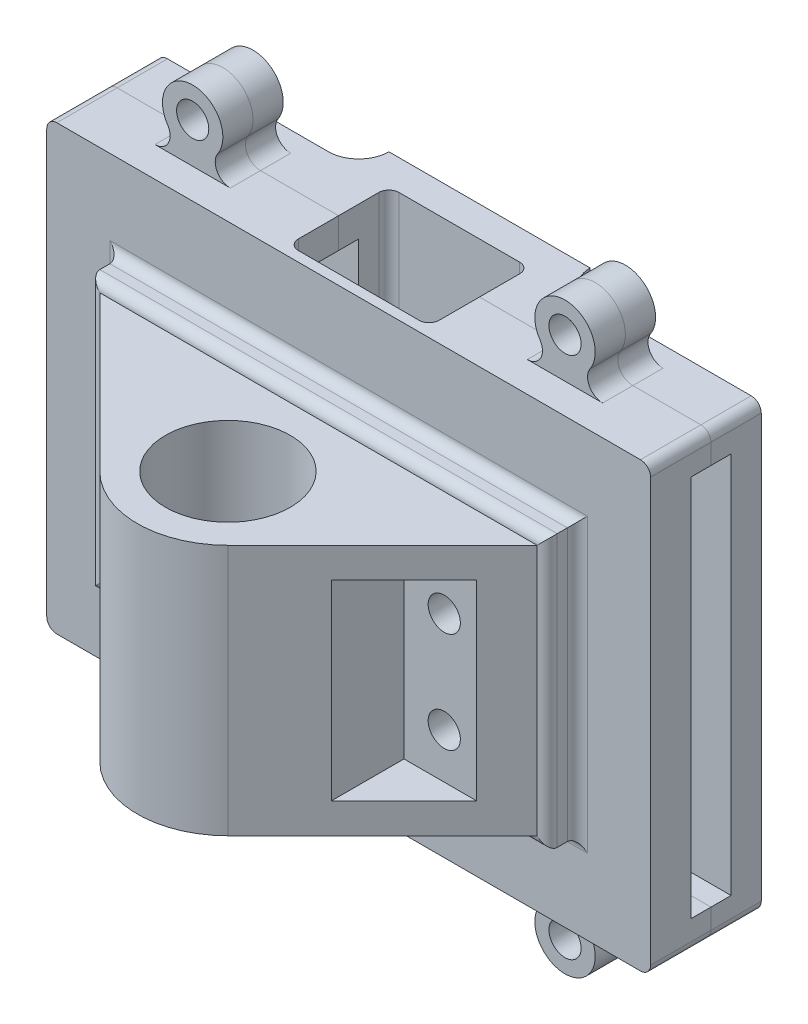
from build123d import *

# Parameters (mm, degrees)
EXTRUDE_1_DEPTH     = 25
SKETCH_2_R          = 6.2
CUT_EXTRUDE_1_DEPTH = 20
SKETCH_3_W          = 18.236171571
SKETCH_3_H          = 19
CUT_EXTRUDE_2_DEPTH = 15
SKETCH_5_W          = 60
SKETCH_5_H          = 44
EXTRUDE_2_DEPTH     = 14
SKETCH_6_W          = 4
SKETCH_6_H          = 38
CUT_EXTRUDE_4_DEPTH = 73.933188604
SKETCH_7_W          = 14
SKETCH_7_H          = 44
CUT_EXTRUDE_5_DEPTH = 10
SKETCH_9_R          = 1.6
EXTRUDE_3_DEPTH     = 3
SKETCH_10_W         = 20
SKETCH_10_H         = 44
EXTRUDE_4_DEPTH     = 3
FILLET_1_R          = 3
FILLET_2_R          = 1
FILLET_3_R          = 1
SKETCH_4_R          = 1.6
CUT_EXTRUDE_3_DEPTH = 10
CUT_EXTRUDE_6_DEPTH = 4
CUT_EXTRUDE_START   = -3
SKETCH_11_W         = 45.455844122
SKETCH_11_H         = 27
CUT_EXTRUDE_7_DEPTH = 3
FILLET_4_R          = 1
FILLET_5_R          = 1


# Read off the part's stored shape, not the designer's step: 分割2
with BuildPart() as part:
    # 草图1 → 凸台-拉伸1 (new body)
    with BuildSketch(Plane(origin=(0, 0, 0), x_dir=(1, 0, 0), z_dir=(0, 1, 0))):
        with BuildLine():
            ThreePointArc((-6.363961031, -6.363961031), (-8.314915793, 3.444150891), (-1e-09, 9))
            Line((-1e-09, 9), (-21.727922061, 9))
            Line((-21.727922061, 9), (-6.363961031, -6.363961031))
        make_face()
        with BuildLine():
            Line((21.727922061, 9), (-1e-09, 9))
            ThreePointArc((-1e-09, 9), (6.36396103, 6.363961031), (9, 0))
            ThreePointArc((9, 0), (8.314915793, -3.444150891), (6.363961031, -6.363961031))
            Line((6.363961031, -6.363961031), (21.727922061, 9))
        make_face()
        with BuildLine():
            ThreePointArc((9, 0), (6.36396103, 6.363961031), (-1e-09, 9))
            Line((0, 9), (0, -9))
            ThreePointArc((0, -9), (3.444150891, -8.314915793), (6.363961031, -6.363961031))
            ThreePointArc((6.363961031, -6.363961031), (8.314915793, -3.444150891), (9, 0))
        make_face()
        with BuildLine():
            Line((0, -9), (0, 9))
            ThreePointArc((-1e-09, 9), (-8.314915793, 3.444150891), (-6.363961031, -6.363961031))
            ThreePointArc((-6.363961031, -6.363961031), (-3.444150891, -8.314915793), (0, -9))
        make_face()
    extrude(amount=EXTRUDE_1_DEPTH)

    # 草图2 → 切除-拉伸1 (cut)
    with BuildSketch(Plane(origin=(0, 25, 0), x_dir=(1, 0, 0), z_dir=(0, 1, 0))):
        with Locations(Location((0, 0, 0), (0, 0, 270))):
            Circle(SKETCH_2_R)
    extrude(amount=-CUT_EXTRUDE_1_DEPTH, mode=Mode.SUBTRACT)

    # 草图3 → 切除-拉伸2 (cut)
    with BuildSketch(Plane.XY.offset(9)):
        with Locations((20.618085785, 12.5)):
            Rectangle(SKETCH_3_W, SKETCH_3_H)
        with Locations((-20.618085785, 12.5)):
            Rectangle(SKETCH_3_W, SKETCH_3_H)
    extrude(amount=-CUT_EXTRUDE_2_DEPTH, mode=Mode.SUBTRACT)

    # 草图5 → 凸台-拉伸2 (add)
    with BuildSketch(Plane(origin=(0, 0, -9), x_dir=(-1, 0, 0), z_dir=(0, 0, -1))):
        with Locations((0, 12.5)):
            Rectangle(SKETCH_5_W, SKETCH_5_H)
    extrude(amount=EXTRUDE_2_DEPTH)

    # 草图6 → 切除-拉伸4 (cut, through all)
    with BuildSketch(Plane.ZY.offset(30)):
        with Locations((-18, 12.5)):
            Rectangle(SKETCH_6_W, SKETCH_6_H)
    extrude(amount=-CUT_EXTRUDE_4_DEPTH, mode=Mode.SUBTRACT)

    # 草图7 → 切除-拉伸5 (cut)
    with BuildSketch(Plane(origin=(0, 0, -23), x_dir=(-1, 0, 0), z_dir=(0, 0, -1))):
        with Locations((0, 12.5)):
            Rectangle(SKETCH_7_W, SKETCH_7_H)
    extrude(amount=-CUT_EXTRUDE_5_DEPTH, mode=Mode.SUBTRACT)

    # 草图9 → 凸台-拉伸3 (add, symmetric)
    # profile 1 of 4: a face of its own
    with BuildSketch(Plane(origin=(0, 0, -18), x_dir=(-1, 0, 0), z_dir=(0, 0, -1))):
        with BuildLine():
            Line((-22.241657387, 34.5), (-14.758342613, 34.5))
            ThreePointArc((-14.758342613, 34.5), (-16.081218269, 35.292893219), (-16.005561742, 36.833333333))
            ThreePointArc((-16.005561742, 36.833333333), (-18.5, 41.5), (-20.994438258, 36.833333333))
            ThreePointArc((-20.994438258, 36.833333333), (-20.918781731, 35.292893219), (-22.241657387, 34.5))
        make_face()
        with Locations(Location((-18.5, 38.5, 0), (0, 0, 90))):
            Circle(SKETCH_9_R, mode=Mode.SUBTRACT)
    # profile 2 of 4: a face of its own
    with BuildSketch(Plane(origin=(0, 0, -18), x_dir=(-1, 0, 0), z_dir=(0, 0, -1))):
        with BuildLine():
            Line((22.241657387, 34.5), (14.758342613, 34.5))
            ThreePointArc((14.758342613, 34.5), (16.081218269, 35.292893219), (16.005561742, 36.833333333))
            ThreePointArc((16.005561742, 36.833333333), (18.5, 41.5), (20.994438258, 36.833333333))
            ThreePointArc((20.994438258, 36.833333333), (20.918781731, 35.292893219), (22.241657387, 34.5))
        make_face()
        with Locations(Location((18.5, 38.5, 0), (0, 0, 270))):
            Circle(SKETCH_9_R, mode=Mode.SUBTRACT)
    # profile 3 of 4: a face of its own
    with BuildSketch(Plane(origin=(0, 0, -18), x_dir=(-1, 0, 0), z_dir=(0, 0, -1))):
        with BuildLine():
            Line((-22.241657387, -9.5), (-14.758342613, -9.5))
            ThreePointArc((-14.758342613, -9.5), (-16.081218269, -10.292893219), (-16.005561742, -11.833333333))
            ThreePointArc((-16.005561742, -11.833333333), (-18.5, -16.5), (-20.994438258, -11.833333333))
            ThreePointArc((-20.994438258, -11.833333333), (-20.918781731, -10.292893219), (-22.241657387, -9.5))
        make_face()
        with Locations(Location((-18.5, -13.5, 0), (0, 0, 270))):
            Circle(SKETCH_9_R, mode=Mode.SUBTRACT)
    # profile 4 of 4: a face of its own
    with BuildSketch(Plane(origin=(0, 0, -18), x_dir=(-1, 0, 0), z_dir=(0, 0, -1))):
        with BuildLine():
            Line((22.241657387, -9.5), (14.758342613, -9.5))
            ThreePointArc((14.758342613, -9.5), (16.081218269, -10.292893219), (16.005561742, -11.833333333))
            ThreePointArc((16.005561742, -11.833333333), (18.5, -16.5), (20.994438258, -11.833333333))
            ThreePointArc((20.994438258, -11.833333333), (20.918781731, -10.292893219), (22.241657387, -9.5))
        make_face()
        with Locations(Location((18.5, -13.5, 0), (0, 0, 90))):
            Circle(SKETCH_9_R, mode=Mode.SUBTRACT)
    extrude(amount=EXTRUDE_3_DEPTH, both=True)

    # 草图10 → 凸台-拉伸4 (add)
    with BuildSketch(Plane(origin=(0, 0, -23), x_dir=(-1, 0, 0), z_dir=(0, 0, -1))):
        with Locations((0, 12.5)):
            Rectangle(SKETCH_10_W, SKETCH_10_H)
    extrude(amount=EXTRUDE_4_DEPTH)

    # 圆角1
    fillet_1_edges = [part.edges().sort_by_distance(p)[0] for p in [
        (-10, 12.5, -23),
        (10, 12.5, -23),
    ]]
    fillet(fillet_1_edges, radius=FILLET_1_R - 0.0001)  # a hair under: the kernel refuses the full size

    # 圆角2
    fillet_2_edges = [part.edges().sort_by_distance(p)[0] for p in [
        (-7, 12.5, -13),
        (7, 12.5, -13),
        (-7, 12.5, -23),
        (7, 12.5, -23),
    ]]
    fillet(fillet_2_edges, radius=FILLET_2_R)

    # 圆角3
    fillet_3_edges = [part.edges().sort_by_distance(p)[0] for p in [
        (-30, -9.5, -16),
        (-30, 34.5, -16),
        (30, 34.5, -16),
        (30, -9.5, -16),
    ]]
    fillet(fillet_3_edges, radius=FILLET_3_R)


with BuildPart() as body_2:
    # Split Bodies 1: the piece on the far side of the plane
    add(part.part)
    split(bisect_by=Plane(origin=(0, 0, -18), x_dir=(0, -1, 0), z_dir=(0, 0, -1)), keep=Keep.BOTTOM)

    # 草图4 → 切除-拉伸3 (cut)
    with BuildSketch(Plane.XY.offset(-6)):
        with Locations((-15.5, 17.5)):
            Circle(SKETCH_4_R)
        with Locations((-15.5, 7.5)):
            Circle(SKETCH_4_R)
        with Locations((15.5, 7.5)):
            Circle(SKETCH_4_R)
        with Locations((15.5, 17.5)):
            Circle(SKETCH_4_R)
    extrude(amount=-CUT_EXTRUDE_3_DEPTH, mode=Mode.SUBTRACT)

    # 草图8 → 切除-拉伸6 (cut)
    with BuildSketch(Plane(origin=(0, 0, -16), x_dir=(-1, 0, 0), z_dir=(0, 0, -1))):
        Polygon((17.174315781, 10.4), (18.848631561, 7.5), (17.174315781, 4.6), (13.825684219, 4.6), (12.151368439, 7.5), (13.825684219, 10.4), align=None)
        Polygon((18.848631561, 17.5), (17.174315781, 20.4), (13.825684219, 20.4), (12.151368439, 17.5), (13.825684219, 14.6), (17.174315781, 14.6), align=None)
        Polygon((-13.825684219, 10.4), (-17.174315781, 10.4), (-18.848631561, 7.5), (-17.174315781, 4.6), (-13.825684219, 4.6), (-12.151368439, 7.5), align=None)
        Polygon((-17.174315781, 14.6), (-18.848631561, 17.5), (-17.174315781, 20.4), (-13.825684219, 20.4), (-12.151368439, 17.5), (-13.825684219, 14.6), align=None)
    extrude(amount=-CUT_EXTRUDE_6_DEPTH, mode=Mode.SUBTRACT)

    # 草图11 → 切除-拉伸7 (cut)
    with BuildSketch(Plane.XY.offset(-9).offset(CUT_EXTRUDE_START)):
        with BuildLine():
            Line((-29, -9.5), (29, -9.5))
            ThreePointArc((29, -9.5), (29.707106781, -9.207106781), (30, -8.5))
            Line((30, -8.5), (30, 33.5))
            ThreePointArc((30, 33.5), (29.707106781, 34.207106781), (29, 34.5))
            Line((29, 34.5), (-29, 34.5))
            ThreePointArc((-29, 34.5), (-29.707106781, 34.207106781), (-30, 33.5))
            Line((-30, 33.5), (-30, -8.5))
            ThreePointArc((-30, -8.5), (-29.707106781, -9.207106781), (-29, -9.5))
        make_face()
        with Locations((0, 12.5)):
            Rectangle(SKETCH_11_W, SKETCH_11_H, mode=Mode.SUBTRACT)
    extrude(amount=CUT_EXTRUDE_7_DEPTH, mode=Mode.SUBTRACT)


with BuildPart() as part_1:
    add(part.part)

    # Split Bodies 1
    split(bisect_by=Plane(origin=(0, 0, -18), x_dir=(0, -1, 0), z_dir=(0, 0, -1)), keep=Keep.TOP)


with BuildPart() as body_3:
    # Split Bodies 2: the piece on the far side of the plane
    add(body_2.part)
    split(bisect_by=Plane.XY.offset(-9), keep=Keep.BOTTOM)

    # 圆角4
    fillet_4_edges = [body_3.edges().sort_by_distance(p)[0] for p in [
        (-22.727922061, 12.5, -12),
        (0, -1, -12),
        (22.727922061, 12.5, -12),
        (0, 26, -12),
    ]]
    fillet(fillet_4_edges, radius=FILLET_4_R)

    # 圆角5
    fillet_5_edges = [body_3.edges().sort_by_distance(p)[0] for p in [
        (-22.727922061, 12.5, -9),
        (0, -1, -9),
        (22.727922061, 12.5, -9),
        (0, 26, -9),
    ]]
    fillet(fillet_5_edges, radius=FILLET_5_R)


with BuildPart() as body_2_1:
    add(body_2.part)

    # Split Bodies 2
    split(bisect_by=Plane.XY.offset(-9), keep=Keep.TOP)


solid = Compound([part_1.part, body_3.part, body_2_1.part])
